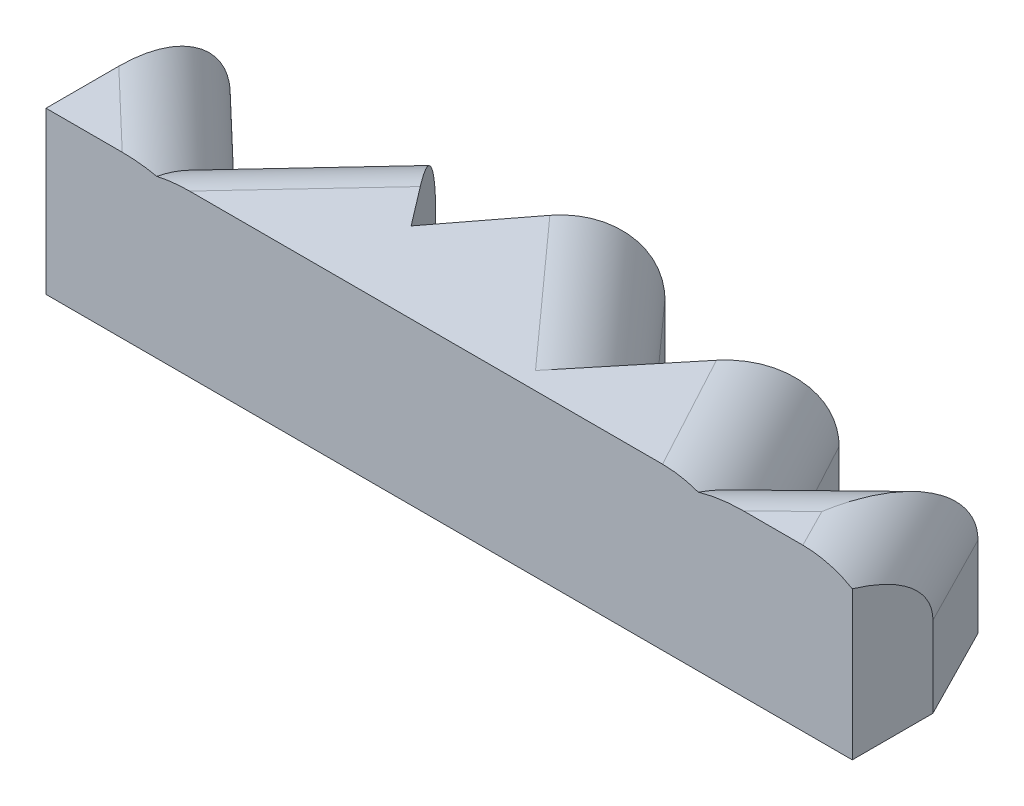
from build123d import *

# Parameters (mm, degrees)
SKETCH1_W           = 127
SKETCH1_H           = 12.7
BOSS_EXTRUDE1_DEPTH = 25.4
BOSS_EXTRUDE2_DEPTH = 25.4
FILLET2_R           = 12.7


with BuildPart() as part:
    # Sketch1 → Boss-Extrude1 (new body)
    with BuildSketch(Plane(origin=(0, 129.522150418, 0), x_dir=(1, 0, 0), z_dir=(0, 1, 0))):
        with Locations((31.151863223, -12.926286206)):
            Rectangle(SKETCH1_W, SKETCH1_H)
    extrude(amount=-BOSS_EXTRUDE1_DEPTH)

    # Sketch2 → Boss-Extrude2 (add)
    with BuildSketch(Plane(origin=(0, 129.522150418, 0), x_dir=(1, 0, 0), z_dir=(0, 1, 0))):
        Polygon((-32.348136777, -6.576286206), (-32.348136777, 9.752049173), (-15.252779509, -6.576286206), (0, 9.752049173), (12.467334528, -6.576286206), (29.798968938, 16.059617503), (50.135874056, -6.576286206), (63.546845791, 9.752049173), (72.350442693, -6.576286206), (87.272954796, 7.906046983), (94.651863223, -6.576286206), (94.651863223, -10.496577103), (-32.348136777, -10.496577103), align=None)
    extrude(amount=-BOSS_EXTRUDE2_DEPTH)

    # Fillet2
    # the kernel refuses this fillet: 12.7 mm, written as the material it takes off along each edge
    with BuildSketch(Plane(origin=(-55.307939563, 129.522150418, -31.681708451), x_dir=(0, -1, 0), z_dir=(0.7231433948257096, 0, 0.6906979300098909))) as fillet2_piece_1_section:
        with BuildLine():
            CenterArc((FILLET2_R, -FILLET2_R), FILLET2_R, 90, 90)
            Line((0, -FILLET2_R), (-FILLET2_R * 0.02, -FILLET2_R))
            Line((-FILLET2_R * 0.02, -FILLET2_R), (-FILLET2_R * 0.02, FILLET2_R * 0.02))
            Line((-FILLET2_R * 0.02, FILLET2_R * 0.02), (FILLET2_R, FILLET2_R * 0.02))
            Line((FILLET2_R, FILLET2_R * 0.02), (FILLET2_R, 0))
        make_face()
    fillet2_piece_1 = extrude(amount=87.140342137, mode=Mode.PRIVATE)
    fillet2_piece_1 = split(fillet2_piece_1, bisect_by=Plane(origin=(-32.348136777, 126.447150631, 1.093343092), z_dir=(1, 0, 0)), keep=Keep.TOP, mode=Mode.PRIVATE)
    fillet2_piece_1 = split(fillet2_piece_1, bisect_by=Plane(origin=(-16.904261861, 126.447150631, 8.344223498), z_dir=(-0.7307649934126457, 0, -0.682629126541357)), keep=Keep.TOP, mode=Mode.PRIVATE)
    add(fillet2_piece_1, mode=Mode.SUBTRACT)
    with BuildSketch(Plane(origin=(-36.926254277, 129.522150418, 29.778074747), x_dir=(0, -1, 0), z_dir=(0.682629126541357, 0, -0.7307649934126457))) as fillet2_piece_2_section:
        with BuildLine():
            CenterArc((FILLET2_R, -FILLET2_R), FILLET2_R, 90, 90)
            Line((0, -FILLET2_R), (-FILLET2_R * 0.02, -FILLET2_R))
            Line((-FILLET2_R * 0.02, -FILLET2_R), (-FILLET2_R * 0.02, FILLET2_R * 0.02))
            Line((-FILLET2_R * 0.02, FILLET2_R * 0.02), (FILLET2_R, FILLET2_R * 0.02))
            Line((FILLET2_R, FILLET2_R * 0.02), (FILLET2_R, 0))
        make_face()
    fillet2_piece_2 = extrude(amount=85.844167449, mode=Mode.PRIVATE)
    fillet2_piece_2 = split(fillet2_piece_2, bisect_by=Plane(origin=(-13.300421888, 126.615006844, 8.441046884), z_dir=(0.6906979300098909, 0, -0.7231433948257096)), keep=Keep.TOP, mode=Mode.PRIVATE)
    fillet2_piece_2 = split(fillet2_piece_2, bisect_by=Plane(origin=(2.843037706, 126.615006844, -6.02855294), z_dir=(-0.7948048188192111, 0, 0.6068651415114903)), keep=Keep.TOP, mode=Mode.PRIVATE)
    add(fillet2_piece_2, mode=Mode.SUBTRACT)
    with BuildSketch(Plane(origin=(72.859080389, 129.522150418, -36.195669189), x_dir=(0, -1, 0), z_dir=(0.45398029626708136, 0, 0.8910117230436719))) as fillet2_piece_3_section:
        with BuildLine():
            CenterArc((FILLET2_R, -FILLET2_R), FILLET2_R, 90, 90)
            Line((0, -FILLET2_R), (-FILLET2_R * 0.02, -FILLET2_R))
            Line((-FILLET2_R * 0.02, -FILLET2_R), (-FILLET2_R * 0.02, FILLET2_R * 0.02))
            Line((-FILLET2_R * 0.02, FILLET2_R * 0.02), (FILLET2_R, FILLET2_R * 0.02))
            Line((FILLET2_R, FILLET2_R * 0.02), (FILLET2_R, 0))
        make_face()
    fillet2_piece_3 = extrude(amount=79.753807682, mode=Mode.PRIVATE)
    fillet2_piece_3 = split(fillet2_piece_3, bisect_by=Plane(origin=(82.345210733, 126.995605854, -3.123659748), z_dir=(0.6964436437658211, 0, 0.7176114903331651)), keep=Keep.TOP, mode=Mode.PRIVATE)
    fillet2_piece_3 = split(fillet2_piece_3, bisect_by=Plane(origin=(94.651863223, 126.995605854, 4.414676038), z_dir=(-1, 0, 0)), keep=Keep.TOP, mode=Mode.PRIVATE)
    add(fillet2_piece_3, mode=Mode.SUBTRACT)
    with BuildSketch(Plane(origin=(49.566277875, 129.522150418, 28.688371895), x_dir=(0, -1, 0), z_dir=(0.7176114903331651, 0, -0.6964436437658211))) as fillet2_piece_4_section:
        with BuildLine():
            CenterArc((FILLET2_R, -FILLET2_R), FILLET2_R, 90, 90)
            Line((0, -FILLET2_R), (-FILLET2_R * 0.02, -FILLET2_R))
            Line((-FILLET2_R * 0.02, -FILLET2_R), (-FILLET2_R * 0.02, FILLET2_R * 0.02))
            Line((-FILLET2_R * 0.02, FILLET2_R * 0.02), (FILLET2_R, FILLET2_R * 0.02))
            Line((FILLET2_R, FILLET2_R * 0.02), (FILLET2_R, 0))
        make_face()
    fillet2_piece_4 = extrude(amount=84.294695045, mode=Mode.PRIVATE)
    fillet2_piece_4 = split(fillet2_piece_4, bisect_by=Plane(origin=(72.424381475, 126.641527383, 6.713423019), z_dir=(0.8802140747510399, 0, -0.4745768458428739)), keep=Keep.TOP, mode=Mode.PRIVATE)
    fillet2_piece_4 = split(fillet2_piece_4, bisect_by=Plane(origin=(90.021052177, 126.641527383, -2.512449501), z_dir=(-0.8910117230436719, 0, 0.45398029626708136)), keep=Keep.TOP, mode=Mode.PRIVATE)
    add(fillet2_piece_4, mode=Mode.SUBTRACT)
    with BuildSketch(Plane(origin=(48.479030935, 129.522150418, -37.698846047), x_dir=(0, -1, 0), z_dir=(0.47457684584287385, 0, 0.8802140747510397))) as fillet2_piece_5_section:
        with BuildLine():
            CenterArc((FILLET2_R, -FILLET2_R), FILLET2_R, 90, 90)
            Line((0, -FILLET2_R), (-FILLET2_R * 0.02, -FILLET2_R))
            Line((-FILLET2_R * 0.02, -FILLET2_R), (-FILLET2_R * 0.02, FILLET2_R * 0.02))
            Line((-FILLET2_R * 0.02, FILLET2_R * 0.02), (FILLET2_R, FILLET2_R * 0.02))
            Line((FILLET2_R, FILLET2_R * 0.02), (FILLET2_R, 0))
        make_face()
    fillet2_piece_5 = extrude(amount=82.050413868, mode=Mode.PRIVATE)
    fillet2_piece_5 = split(fillet2_piece_5, bisect_by=Plane(origin=(59.422424103, 126.616162938, -4.730418982), z_dir=(0.7727631490947523, 0, 0.6346945055703268)), keep=Keep.TOP, mode=Mode.PRIVATE)
    fillet2_piece_5 = split(fillet2_piece_5, bisect_by=Plane(origin=(72.023472886, 126.616162938, 6.893611175), z_dir=(-0.6964436437658211, 0, -0.7176114903331651)), keep=Keep.TOP, mode=Mode.PRIVATE)
    add(fillet2_piece_5, mode=Mode.SUBTRACT)
    with BuildSketch(Plane(origin=(8.579757917, 129.522150418, -39.677567957), x_dir=(0, -1, 0), z_dir=(0.668321606968674, 0, 0.7438724552359828))) as fillet2_piece_6_section:
        with BuildLine():
            CenterArc((FILLET2_R, -FILLET2_R), FILLET2_R, 90, 90)
            Line((0, -FILLET2_R), (-FILLET2_R * 0.02, -FILLET2_R))
            Line((-FILLET2_R * 0.02, -FILLET2_R), (-FILLET2_R * 0.02, FILLET2_R * 0.02))
            Line((-FILLET2_R * 0.02, FILLET2_R * 0.02), (FILLET2_R, FILLET2_R * 0.02))
            Line((FILLET2_R, FILLET2_R * 0.02), (FILLET2_R, 0))
        make_face()
    fillet2_piece_6 = extrude(amount=93.929818377, mode=Mode.PRIVATE)
    fillet2_piece_6 = split(fillet2_piece_6, bisect_by=Plane(origin=(26.326574594, 126.641800239, -11.524512379), z_dir=(0.7939882740207107, 0, 0.6079330725644171)), keep=Keep.TOP, mode=Mode.PRIVATE)
    fillet2_piece_6 = split(fillet2_piece_6, bisect_by=Plane(origin=(49.745548911, 126.641800239, 7.051520961), z_dir=(-0.7727631490947523, 0, -0.6346945055703268)), keep=Keep.TOP, mode=Mode.PRIVATE)
    add(fillet2_piece_6, mode=Mode.SUBTRACT)
    with BuildSketch(Plane(origin=(-55.307939563, 129.522150418, -31.681708451), x_dir=(0, -1, 0), z_dir=(0.7231433948257096, 0, 0.6906979300098909))) as fillet2_piece_7a_section:
        with BuildLine():
            CenterArc((FILLET2_R, -FILLET2_R), FILLET2_R, 90, 90)
            Line((0, -FILLET2_R), (-FILLET2_R * 0.02, -FILLET2_R))
            Line((-FILLET2_R * 0.02, -FILLET2_R), (-FILLET2_R * 0.02, FILLET2_R * 0.02))
            Line((-FILLET2_R * 0.02, FILLET2_R * 0.02), (FILLET2_R, FILLET2_R * 0.02))
            Line((FILLET2_R, FILLET2_R * 0.02), (FILLET2_R, 0))
        make_face()
    fillet2_piece_7a = extrude(amount=87.140342137, mode=Mode.PRIVATE)
    fillet2_piece_7a = split(fillet2_piece_7a, bisect_by=Plane(origin=(-17.333974575, 126.645382706, 8.804237577), z_dir=(0.7307649934126457, 0, 0.682629126541357)), keep=Keep.TOP, mode=Mode.PRIVATE)
    with BuildSketch(Plane(origin=(-36.926254277, 129.522150418, 29.778074747), x_dir=(0, -1, 0), z_dir=(0.682629126541357, 0, -0.7307649934126457))) as fillet2_piece_7b_section:
        with BuildLine():
            CenterArc((FILLET2_R, -FILLET2_R), FILLET2_R, 90, 90)
            Line((0, -FILLET2_R), (-FILLET2_R * 0.02, -FILLET2_R))
            Line((-FILLET2_R * 0.02, -FILLET2_R), (-FILLET2_R * 0.02, FILLET2_R * 0.02))
            Line((-FILLET2_R * 0.02, FILLET2_R * 0.02), (FILLET2_R, FILLET2_R * 0.02))
            Line((FILLET2_R, FILLET2_R * 0.02), (FILLET2_R, 0))
        make_face()
    fillet2_piece_7b = extrude(amount=85.844167449, mode=Mode.PRIVATE)
    fillet2_piece_7b = split(fillet2_piece_7b, bisect_by=Plane(origin=(-13.048064816, 126.645382706, 8.682081385), z_dir=(-0.6906979300098909, 0, 0.7231433948257096)), keep=Keep.TOP, mode=Mode.PRIVATE)
    fillet2_piece_7 = fillet2_piece_7a & fillet2_piece_7b
    add(fillet2_piece_7, mode=Mode.SUBTRACT)
    with BuildSketch(Plane(origin=(49.566277875, 129.522150418, 28.688371895), x_dir=(0, -1, 0), z_dir=(0.7176114903331651, 0, -0.6964436437658211))) as fillet2_piece_8a_section:
        with BuildLine():
            CenterArc((FILLET2_R, -FILLET2_R), FILLET2_R, 90, 90)
            Line((0, -FILLET2_R), (-FILLET2_R * 0.02, -FILLET2_R))
            Line((-FILLET2_R * 0.02, -FILLET2_R), (-FILLET2_R * 0.02, FILLET2_R * 0.02))
            Line((-FILLET2_R * 0.02, FILLET2_R * 0.02), (FILLET2_R, FILLET2_R * 0.02))
            Line((FILLET2_R, FILLET2_R * 0.02), (FILLET2_R, 0))
        make_face()
    fillet2_piece_8a = extrude(amount=84.294695045, mode=Mode.PRIVATE)
    fillet2_piece_8a = split(fillet2_piece_8a, bisect_by=Plane(origin=(86.487490403, 126.688787651, -9.447651295), z_dir=(0.8910117230436719, 0, -0.45398029626708136)), keep=Keep.TOP, mode=Mode.PRIVATE)
    with BuildSketch(Plane(origin=(72.859080389, 129.522150418, -36.195669189), x_dir=(0, -1, 0), z_dir=(0.45398029626708136, 0, 0.8910117230436719))) as fillet2_piece_8b_section:
        with BuildLine():
            CenterArc((FILLET2_R, -FILLET2_R), FILLET2_R, 90, 90)
            Line((0, -FILLET2_R), (-FILLET2_R * 0.02, -FILLET2_R))
            Line((-FILLET2_R * 0.02, -FILLET2_R), (-FILLET2_R * 0.02, FILLET2_R * 0.02))
            Line((-FILLET2_R * 0.02, FILLET2_R * 0.02), (FILLET2_R, FILLET2_R * 0.02))
            Line((FILLET2_R, FILLET2_R * 0.02), (FILLET2_R, 0))
        make_face()
    fillet2_piece_8b = extrude(amount=79.753807682, mode=Mode.PRIVATE)
    fillet2_piece_8b = split(fillet2_piece_8b, bisect_by=Plane(origin=(88.514546729, 126.688787651, -9.111014882), z_dir=(-0.6964436437658211, 0, -0.7176114903331651)), keep=Keep.TOP, mode=Mode.PRIVATE)
    fillet2_piece_8 = fillet2_piece_8a & fillet2_piece_8b
    add(fillet2_piece_8, mode=Mode.SUBTRACT)
    with BuildSketch(Plane(origin=(48.479030935, 129.522150418, -37.698846047), x_dir=(0, -1, 0), z_dir=(0.47457684584287385, 0, 0.8802140747510397))) as fillet2_piece_9a_section:
        with BuildLine():
            CenterArc((FILLET2_R, -FILLET2_R), FILLET2_R, 90, 90)
            Line((0, -FILLET2_R), (-FILLET2_R * 0.02, -FILLET2_R))
            Line((-FILLET2_R * 0.02, -FILLET2_R), (-FILLET2_R * 0.02, FILLET2_R * 0.02))
            Line((-FILLET2_R * 0.02, FILLET2_R * 0.02), (FILLET2_R, FILLET2_R * 0.02))
            Line((FILLET2_R, FILLET2_R * 0.02), (FILLET2_R, 0))
        make_face()
    fillet2_piece_9a = extrude(amount=82.050413868, mode=Mode.PRIVATE)
    fillet2_piece_9a = split(fillet2_piece_9a, bisect_by=Plane(origin=(67.231034688, 126.606396311, 11.544683748), z_dir=(0.6964436437658211, 0, 0.7176114903331651)), keep=Keep.TOP, mode=Mode.PRIVATE)
    with BuildSketch(Plane(origin=(49.566277875, 129.522150418, 28.688371895), x_dir=(0, -1, 0), z_dir=(0.7176114903331651, 0, -0.6964436437658211))) as fillet2_piece_9b_section:
        with BuildLine():
            CenterArc((FILLET2_R, -FILLET2_R), FILLET2_R, 90, 90)
            Line((0, -FILLET2_R), (-FILLET2_R * 0.02, -FILLET2_R))
            Line((-FILLET2_R * 0.02, -FILLET2_R), (-FILLET2_R * 0.02, FILLET2_R * 0.02))
            Line((-FILLET2_R * 0.02, FILLET2_R * 0.02), (FILLET2_R, FILLET2_R * 0.02))
            Line((FILLET2_R, FILLET2_R * 0.02), (FILLET2_R, 0))
        make_face()
    fillet2_piece_9b = extrude(amount=84.294695045, mode=Mode.PRIVATE)
    fillet2_piece_9b = split(fillet2_piece_9b, bisect_by=Plane(origin=(75.736052506, 126.606396311, 12.855693714), z_dir=(-0.8802140747510399, 0, 0.4745768458428739)), keep=Keep.TOP, mode=Mode.PRIVATE)
    fillet2_piece_9 = fillet2_piece_9a & fillet2_piece_9b
    add(fillet2_piece_9, mode=Mode.SUBTRACT)


solid = part.part
